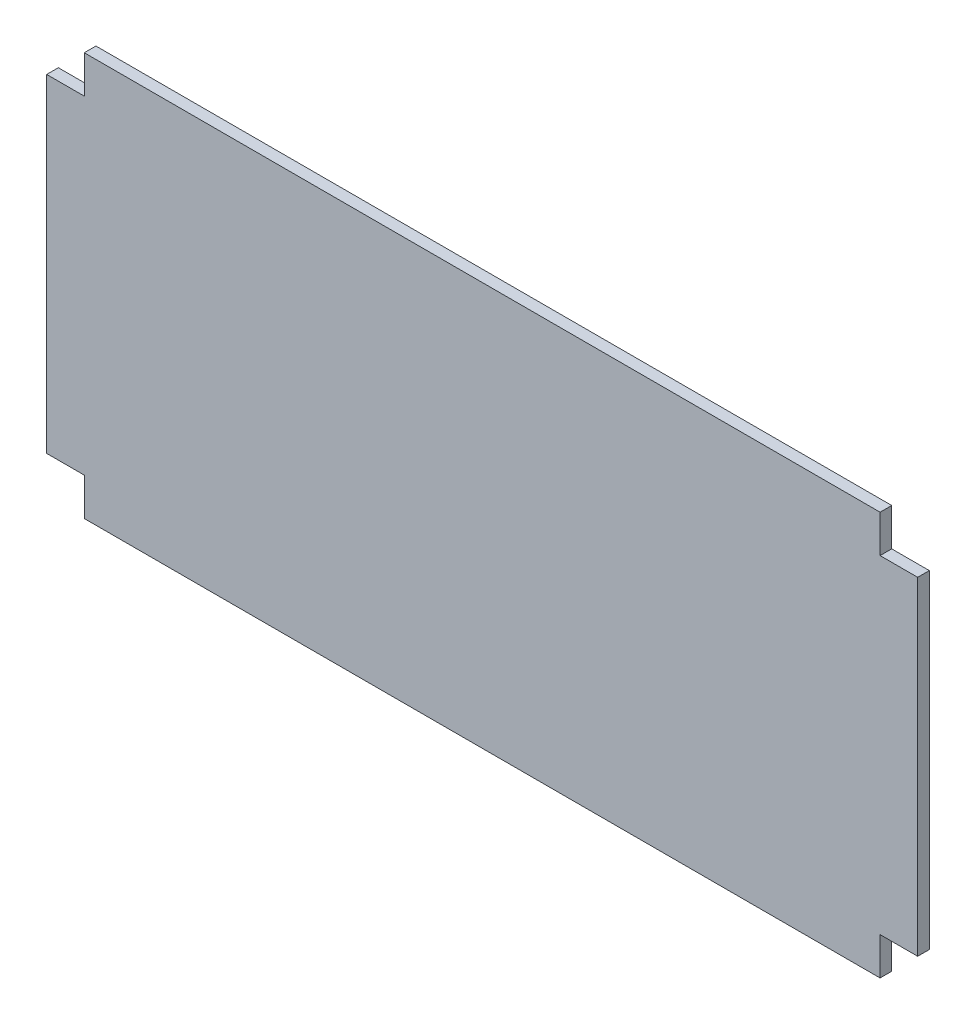
from build123d import *

# Parameters (mm, degrees)
SKETCH2_W           = 950
SKETCH2_H           = 440
BOSS_EXTRUDE1_DEPTH = 12.7
CUT_EXTRUDE1_REACH  = 525.628
SKETCH3_W           = 41
SKETCH3_H           = 41


with BuildPart() as part:
    # Sketch2 → Boss-Extrude1 (new body)
    with BuildSketch(Plane.XY):
        Rectangle(SKETCH2_W, SKETCH2_H)
    extrude(amount=BOSS_EXTRUDE1_DEPTH)

    # Sketch3 → Cut-Extrude1 (cut, up to next)
    with BuildSketch(Plane.XY.offset(12.7), mode=Mode.PRIVATE) as cut_extrude1_sk1:
        with Locations((-454.5, 199.5)):
            Rectangle(SKETCH3_W, SKETCH3_H)
    cut_extrude1_tool1 = extrude(cut_extrude1_sk1.sketch, amount=-CUT_EXTRUDE1_REACH, mode=Mode.PRIVATE) & part.part
    # Sketch3 → Cut-Extrude1 (cut, up to next)
    with BuildSketch(Plane.XY.offset(12.7), mode=Mode.PRIVATE) as cut_extrude1_sk2:
        with Locations((454.5, 199.5)):
            Rectangle(SKETCH3_W, SKETCH3_H)
    cut_extrude1_tool2 = extrude(cut_extrude1_sk2.sketch, amount=-CUT_EXTRUDE1_REACH, mode=Mode.PRIVATE) & part.part
    # Sketch3 → Cut-Extrude1 (cut, up to next)
    with BuildSketch(Plane.XY.offset(12.7), mode=Mode.PRIVATE) as cut_extrude1_sk3:
        with Locations((454.5, -199.5)):
            Rectangle(SKETCH3_W, SKETCH3_H)
    cut_extrude1_tool3 = extrude(cut_extrude1_sk3.sketch, amount=-CUT_EXTRUDE1_REACH, mode=Mode.PRIVATE) & part.part
    # Sketch3 → Cut-Extrude1 (cut, up to next)
    with BuildSketch(Plane.XY.offset(12.7), mode=Mode.PRIVATE) as cut_extrude1_sk4:
        with Locations((-454.5, -199.5)):
            Rectangle(SKETCH3_W, SKETCH3_H)
    cut_extrude1_tool4 = extrude(cut_extrude1_sk4.sketch, amount=-CUT_EXTRUDE1_REACH, mode=Mode.PRIVATE) & part.part
    add(cut_extrude1_tool1.solids().sort_by_distance((-454.5, 199.5, 12.7))[0], mode=Mode.SUBTRACT)
    add(cut_extrude1_tool2.solids().sort_by_distance((454.5, 199.5, 12.7))[0], mode=Mode.SUBTRACT)
    add(cut_extrude1_tool3.solids().sort_by_distance((454.5, -199.5, 12.7))[0], mode=Mode.SUBTRACT)
    add(cut_extrude1_tool4.solids().sort_by_distance((-454.5, -199.5, 12.7))[0], mode=Mode.SUBTRACT)


solid = part.part
